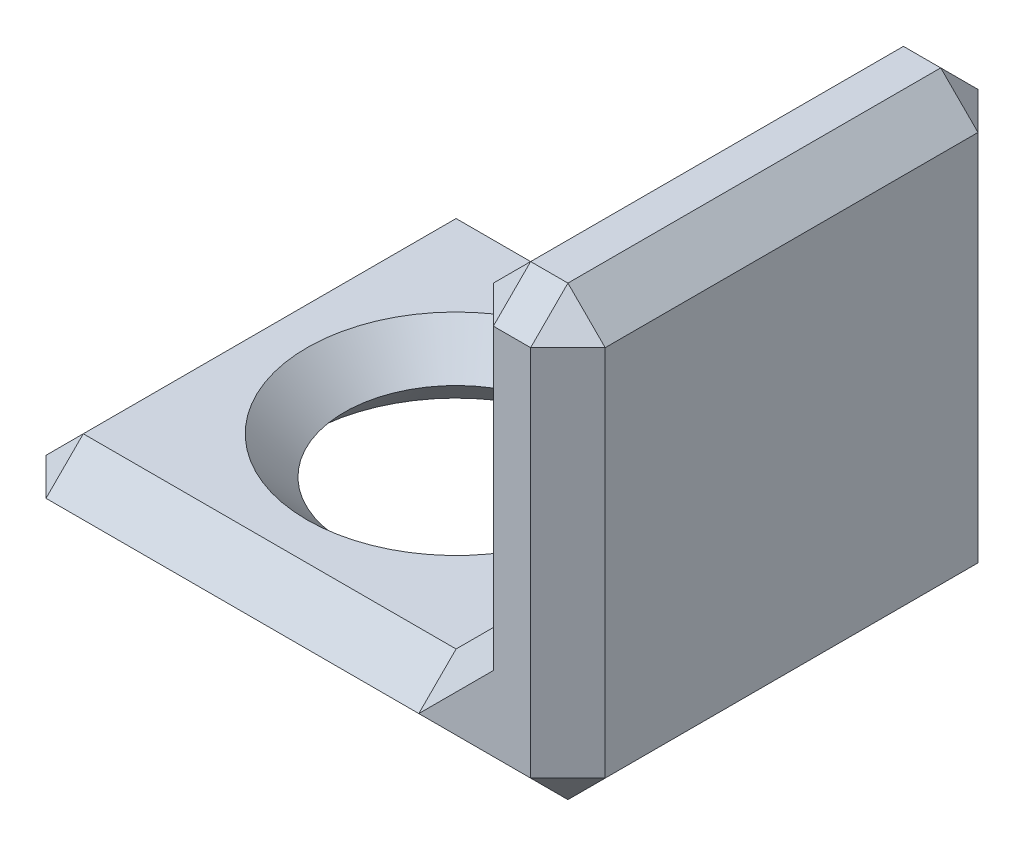
from build123d import *

# Parameters (mm, degrees)
SKETCH_1_W           = 12
SKETCH_1_H           = 12
SKETCH_1_R           = 3
EXTRUDE_1_DEPTH      = 2
EXTRUDE_2_DEPTH      = 10
EXTRUDE_2_DEPTH_BACK = 2
SKETCH_2_W           = 3
SKETCH_2_H           = 12
CHAMFER_1_SIZE       = 1


with BuildPart() as part:
    # 草图1 → 凸台-拉伸1 (new body)
    with BuildSketch(Plane(origin=(0, 0, 0), x_dir=(1, 0, 0), z_dir=(0, 1, 0))):
        with Locations((6, -6)):
            Rectangle(SKETCH_1_W, SKETCH_1_H)
        with Locations(Location((6, -6, 0), (0, 0, 270))):
            Circle(SKETCH_1_R, mode=Mode.SUBTRACT)
    extrude(amount=EXTRUDE_1_DEPTH)

    # 草图2 → 凸台-拉伸2 (add, two sides: drawn at the far end of the back side and taken through both)
    with BuildSketch(Plane(origin=(0, 2, 0), x_dir=(1, 0, 0), z_dir=(0, 1, 0)).offset(-EXTRUDE_2_DEPTH_BACK)):
        with Locations((13.5, -6)):
            Rectangle(SKETCH_2_W, SKETCH_2_H)
    extrude(amount=EXTRUDE_2_DEPTH + EXTRUDE_2_DEPTH_BACK)

    # 倒角1
    chamfer_1_edges = [part.edges().sort_by_distance(p)[0] for p in [
        (6, 0, 3),
        (6, 2, 3),
        (12, 2, 6),
        (6, 2, 0),
        (12, 7, 12),
        (12, 7, 0),
        (15, 6, 0),
        (15, 0, 6),
        (15, 6, 12),
        (12, 12, 6),
        (13.5, 12, 12),
        (15, 12, 6),
        (13.5, 12, 0),
        (0, 2, 6),
        (7.5, 0, 0),
        (7.5, 0, 12),
        (0, 0, 6),
        (0, 1, 0),
        (0, 1, 12),
        (6, 2, 12),
    ]]
    chamfer(chamfer_1_edges, length=CHAMFER_1_SIZE - 0.0001)  # a hair under: the kernel refuses the full size


solid = part.part
